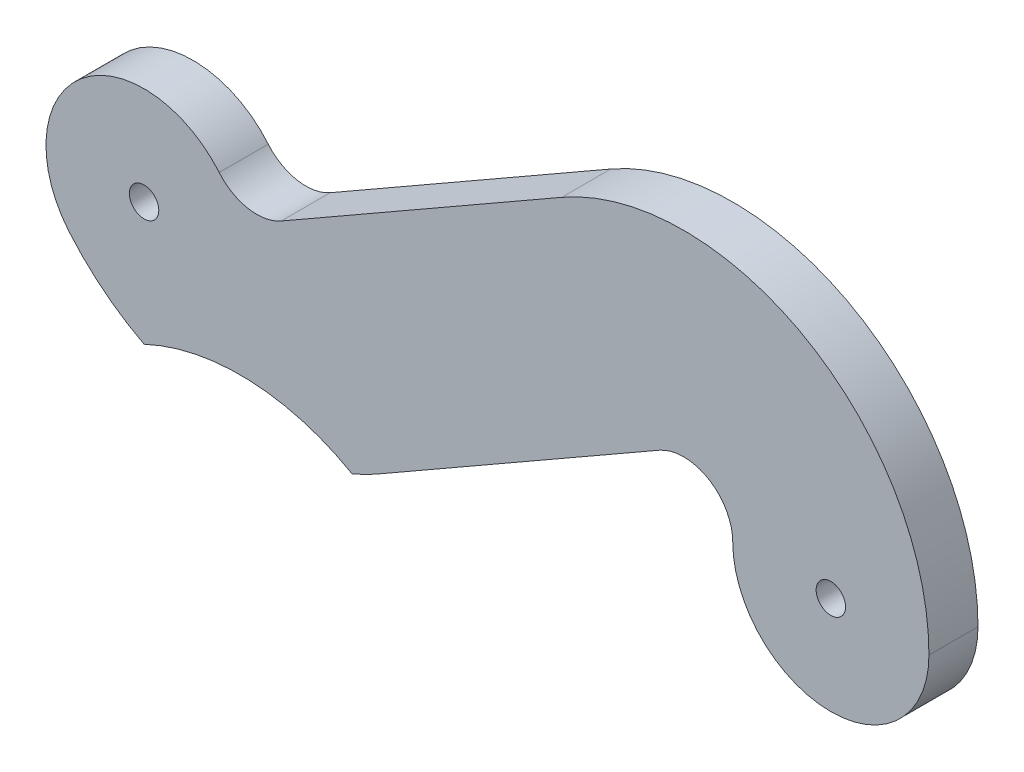
from build123d import *

# Parameters (mm, degrees)
ESQUISSE1_R             = 1.5
BOSS_EXTRU_1_DEPTH      = 5
ENL_V_START             = -10
ENL_V_MAT_EXTRU_1_DEPTH = 10


with BuildPart() as part:
    # Esquisse1 → Boss.-Extru.1 (new body)
    with BuildSketch(Plane.XY):
        with BuildLine():
            Line((13.976873943, 5.303753141), (42.568963518, 21.690305023))
            ThreePointArc((42.568963518, 21.690305023), (67.53443433, 21.63071788), (80, 0))
            ThreePointArc((80, 0), (70, -10), (60, 0))
            ThreePointArc((60, 0), (57.506886866, 4.326143576), (52.513792704, 4.338061005))
            Line((52.513792704, 4.338061005), (23.921703129, -12.048490878))
            ThreePointArc((23.921703129, -12.048490878), (7.110292431, -14.971440855), (-7.660444431, -6.427876097))
            ThreePointArc((-7.660444431, -6.427876097), (-6.427876097, 7.660444431), (7.660444431, 6.427876097))
            ThreePointArc((7.660444431, 6.427876097), (10.614591804, 4.719163145), (13.976873943, 5.303753141))
        make_face()
        with Locations((70, 0)):
            Circle(ESQUISSE1_R, mode=Mode.SUBTRACT)
        Circle(ESQUISSE1_R, mode=Mode.SUBTRACT)
    extrude(amount=BOSS_EXTRU_1_DEPTH)

    # Esquisse2 → Enlèv. mat.-Extru.1 (cut)
    with BuildSketch(Plane.XY.offset(5).offset(ENL_V_START)):
        with BuildLine():
            ThreePointArc((0, -12.560991534), (10.699732017, -10.38625236), (21.19464303, -13.397995801))
            ThreePointArc((21.19464303, -13.397995801), (10.504152805, -15.33871408), (0, -12.560991534))
        make_face()
    extrude(amount=ENL_V_MAT_EXTRU_1_DEPTH, mode=Mode.SUBTRACT)


solid = part.part
